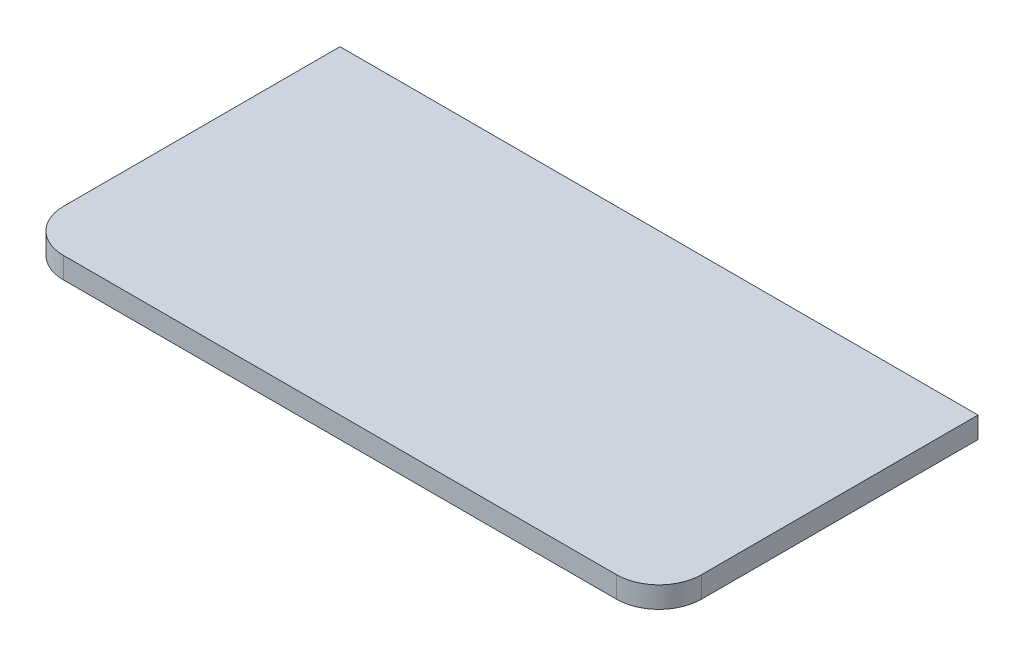
from build123d import *

# Parameters (mm, degrees)
SKIZZE1_W                  = 150
SKIZZE1_H                  = 150
LINEAR_AUSTRAGEN1_DEPTH    = 10
VERRUNDUNG1_R              = 20
VERRUNDUNG1_OF_SPIEGELN2_R = 20


with BuildPart() as part:
    # Skizze1 → Linear austragen1 (new body)
    with BuildSketch(Plane(origin=(0, 0, 0), x_dir=(1, 0, 0), z_dir=(0, 1, 0))):
        with Locations((75, 0)):
            Rectangle(SKIZZE1_W, SKIZZE1_H)
    linear_austragen1 = extrude(amount=LINEAR_AUSTRAGEN1_DEPTH)

    # Verrundung1
    verrundung1_edges = [part.edges().sort_by_distance(p)[0] for p in [
        (150, 5, 75),
    ]]
    fillet(verrundung1_edges, radius=VERRUNDUNG1_R)

    # Spiegeln2: Linear austragen1 across plane
    add(linear_austragen1.mirror(Plane(origin=(0, 10, 75), x_dir=(0, 0, 1), z_dir=(1, 0, 0))))

    # Verrundung1 of Spiegeln2
    verrundung1_of_spiegeln2_edges = [part.edges().sort_by_distance(p)[0] for p in [
        (-150, 5, 75),
    ]]
    fillet(verrundung1_of_spiegeln2_edges, radius=VERRUNDUNG1_OF_SPIEGELN2_R)


solid = part.part
